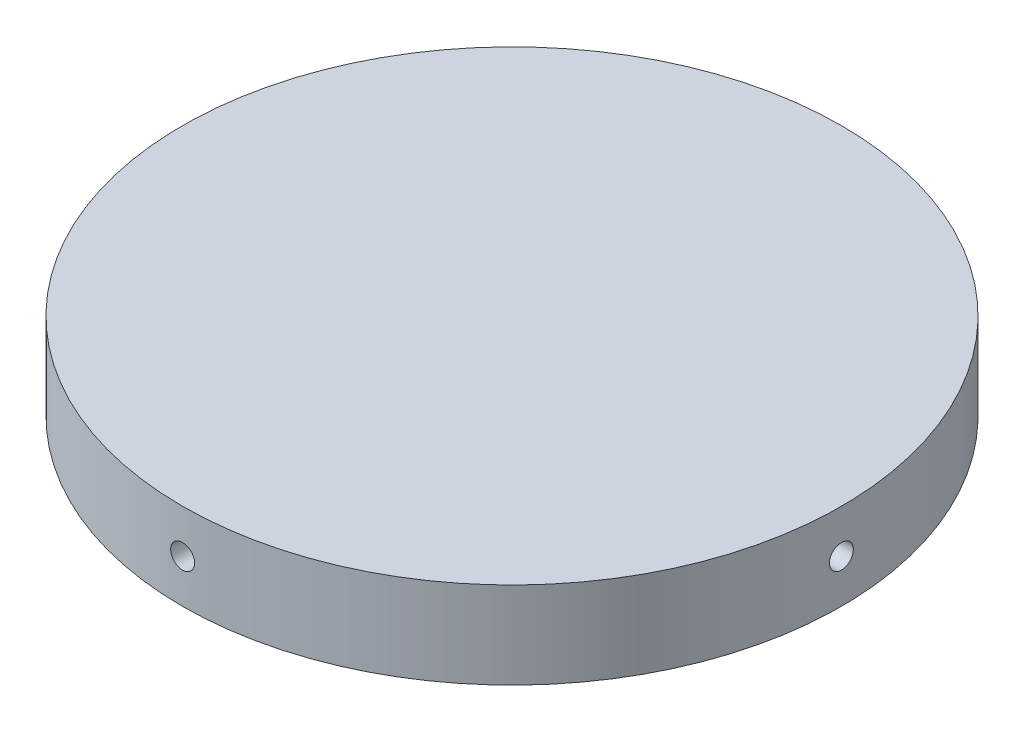
from build123d import *

# Parameters (mm, degrees)
SKETCH1_R                = 48.26
BULKHEAD_EXTRUSION_DEPTH = 12.7
SKETCH2_R                = 1.7526
SCREW_HOLE_DEPTH         = 19.05
CIRPATTERN1_COUNT        = 4


with BuildPart() as part:
    # Sketch1 → Bulkhead Extrusion (new body)
    with BuildSketch(Plane(origin=(0, 0, 0), x_dir=(1, 0, 0), z_dir=(0, 1, 0))):
        Circle(SKETCH1_R)
    extrude(amount=BULKHEAD_EXTRUSION_DEPTH)

    # Sketch2 → Screw Hole (cut)
    with BuildSketch(Plane.XY.offset(48.26)):
        with Locations((0, 6.35)):
            Circle(SKETCH2_R)
    screw_hole = extrude(amount=-SCREW_HOLE_DEPTH, mode=Mode.SUBTRACT)

    # CirPattern1: Screw Hole ×4 about axis
    cirpattern1_axis = Axis((0, 12.7, 0), (0, -1, 0))
    for i in range(1, CIRPATTERN1_COUNT):
        add(screw_hole.rotate(cirpattern1_axis, i * 360 / CIRPATTERN1_COUNT), mode=Mode.SUBTRACT)


solid = part.part
